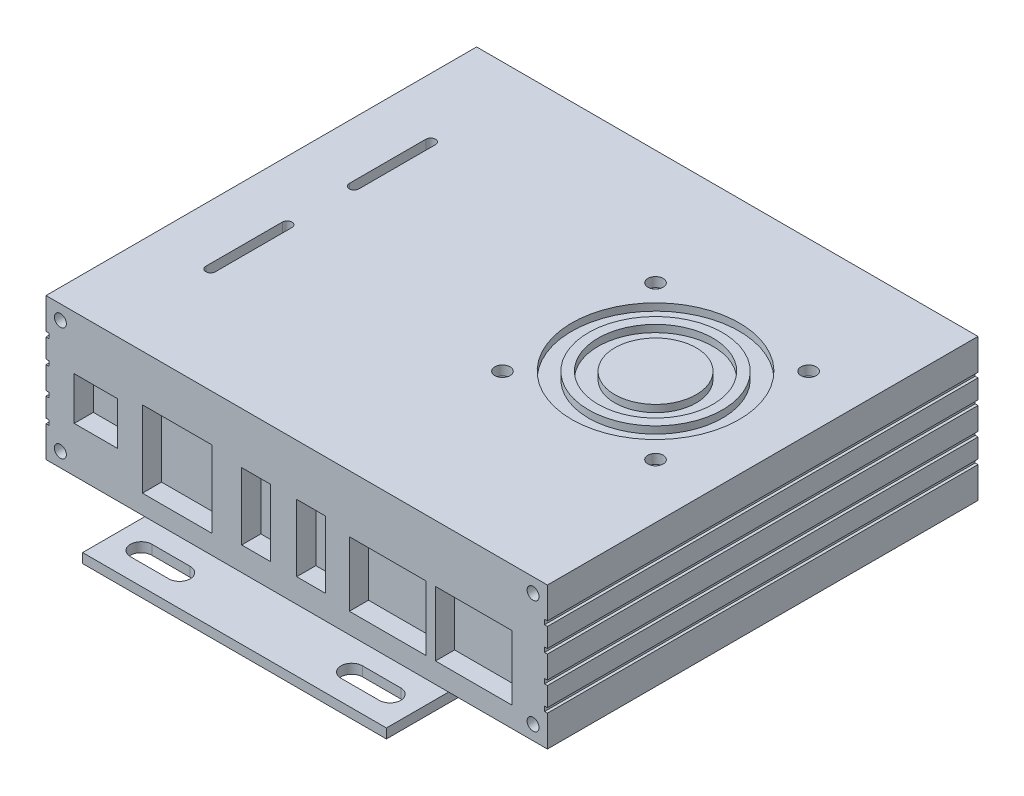
from build123d import *

# Parameters (mm, degrees)
SKETCH1_W           = 104.8
SKETCH1_H           = 90
BOSS_EXTRUDE1_DEPTH = 29.7
SKETCH2_W           = 63.5
SKETCH2_H           = 116
BOSS_EXTRUDE2_DEPTH = 2
CUT_EXTRUDE1_DEPTH  = 3
SKETCH4_R           = 1.25
SKETCH4_W           = 9
SKETCH4_H           = 9
SKETCH4_W_2         = 14.5
SKETCH4_H_2         = 16
SKETCH4_W_3         = 6
SKETCH4_H_3         = 14
SKETCH4_W_4         = 16
SKETCH4_H_4         = 13.5
CUT_EXTRUDE2_DEPTH  = 4
CUT_EXTRUDE4_START  = 2
SKETCH5_R           = 1.25
CUT_EXTRUDE4_DEPTH  = 2
SKETCH6_R           = 17.5
SKETCH6_R_2         = 14
CUT_EXTRUDE5_DEPTH  = 1.5
SKETCH7_R           = 12
SKETCH7_R_2         = 8.5
CUT_EXTRUDE6_DEPTH  = 1.5
SKETCH8_R           = 1.6
CUT_EXTRUDE7_DEPTH  = 2
SKETCH9_W           = 90
SKETCH9_H           = 1
CUT_EXTRUDE8_DEPTH  = 0.6
SKETCH10_W          = 90
SKETCH10_H          = 1
CUT_EXTRUDE10_DEPTH = 0.6


with BuildPart() as part:
    # Sketch1 → Boss-Extrude1 (new body)
    with BuildSketch(Plane(origin=(0, 0, 0), x_dir=(1, 0, 0), z_dir=(0, 1, 0))):
        Rectangle(SKETCH1_W, SKETCH1_H)
    extrude(amount=BOSS_EXTRUDE1_DEPTH)

    # Sketch2 → Boss-Extrude2 (add)
    with BuildSketch(Plane(origin=(0, 0, 0), x_dir=(1, 0, 0), z_dir=(0, 1, 0))):
        Rectangle(SKETCH2_W, SKETCH2_H)
    extrude(amount=-BOSS_EXTRUDE2_DEPTH)

    # Sketch3 → Cut-Extrude1 (cut)
    with BuildSketch(Plane.XZ.offset(2)):
        with BuildLine():
            Line((18, 53.75), (26, 53.75))
            ThreePointArc((26, 53.75), (28.25, 51.5), (26, 49.25))
            Line((26, 49.25), (18, 49.25))
            ThreePointArc((18, 49.25), (15.75, 51.5), (18, 53.75))
        make_face()
        with BuildLine():
            Line((-26, 53.75), (-18, 53.75))
            ThreePointArc((-18, 53.75), (-15.75, 51.5), (-18, 49.25))
            Line((-18, 49.25), (-26, 49.25))
            ThreePointArc((-26, 49.25), (-28.25, 51.5), (-26, 53.75))
        make_face()
        with BuildLine():
            Line((18, -49.25), (26, -49.25))
            ThreePointArc((26, -49.25), (28.25, -51.5), (26, -53.75))
            Line((26, -53.75), (18, -53.75))
            ThreePointArc((18, -53.75), (15.75, -51.5), (18, -49.25))
        make_face()
        with BuildLine():
            Line((-26, -49.25), (-18, -49.25))
            ThreePointArc((-18, -49.25), (-15.75, -51.5), (-18, -53.75))
            Line((-18, -53.75), (-26, -53.75))
            ThreePointArc((-26, -53.75), (-28.25, -51.5), (-26, -49.25))
        make_face()
    extrude(amount=-CUT_EXTRUDE1_DEPTH, mode=Mode.SUBTRACT)

    # Sketch4 → Cut-Extrude2 (cut)
    with BuildSketch(Plane.XY.offset(45)):
        with Locations((49.4, 3)):
            Circle(SKETCH4_R)
        with Locations((49.4, 26.7)):
            Circle(SKETCH4_R)
        with Locations((-49.4, 3)):
            Circle(SKETCH4_R)
        with Locations((-49.4, 26.7)):
            Circle(SKETCH4_R)
        with Locations((-42, 14)):
            Rectangle(SKETCH4_W, SKETCH4_H)
        with Locations((-25, 12)):
            Rectangle(SKETCH4_W_2, SKETCH4_H_2)
        with Locations((-8.5, 12)):
            Rectangle(SKETCH4_W_3, SKETCH4_H_3)
        with Locations((3, 12)):
            Rectangle(SKETCH4_W_3, SKETCH4_H_3)
        with Locations((19, 11)):
            Rectangle(SKETCH4_W_4, SKETCH4_H_4)
        with Locations((37, 11)):
            Rectangle(SKETCH4_W_4, SKETCH4_H_4)
    extrude(amount=-CUT_EXTRUDE2_DEPTH, mode=Mode.SUBTRACT)

    # Sketch5 → Cut-Extrude4 (cut)
    with BuildSketch(Plane.XY.offset(-45).offset(CUT_EXTRUDE4_START)):
        with Locations((49.4, 3)):
            Circle(SKETCH5_R)
        with Locations((49.4, 26.7)):
            Circle(SKETCH5_R)
        with Locations((-49.4, 3)):
            Circle(SKETCH5_R)
        with Locations((-49.4, 26.7)):
            Circle(SKETCH5_R)
    extrude(amount=-CUT_EXTRUDE4_DEPTH, mode=Mode.SUBTRACT)

    # Sketch6 → Cut-Extrude5 (cut)
    with BuildSketch(Plane(origin=(0, 29.7, 0), x_dir=(1, 0, 0), z_dir=(0, 1, 0))):
        with Locations((25, 5)):
            Circle(SKETCH6_R)
        with Locations((25, 5)):
            Circle(SKETCH6_R_2, mode=Mode.SUBTRACT)
    extrude(amount=-CUT_EXTRUDE5_DEPTH, mode=Mode.SUBTRACT)

    # Sketch7 → Cut-Extrude6 (cut)
    with BuildSketch(Plane(origin=(0, 29.7, 0), x_dir=(1, 0, 0), z_dir=(0, 1, 0))):
        with Locations((25, 5)):
            Circle(SKETCH7_R)
        with Locations((25, 5)):
            Circle(SKETCH7_R_2, mode=Mode.SUBTRACT)
    extrude(amount=-CUT_EXTRUDE6_DEPTH, mode=Mode.SUBTRACT)

    # Sketch8 → Cut-Extrude7 (cut)
    with BuildSketch(Plane(origin=(0, 29.7, 0), x_dir=(1, 0, 0), z_dir=(0, 1, 0))):
        with Locations((41, -11)):
            Circle(SKETCH8_R)
        with Locations((41, 21)):
            Circle(SKETCH8_R)
        with Locations((9, -11)):
            Circle(SKETCH8_R)
        with Locations((9, 21)):
            Circle(SKETCH8_R)
        with BuildLine():
            Line((-39, -7), (-39, -23))
            ThreePointArc((-39, -23), (-40, -24), (-41, -23))
            Line((-41, -23), (-41, -7))
            ThreePointArc((-41, -7), (-40, -6), (-39, -7))
        make_face()
        with BuildLine():
            Line((-39, 23), (-39, 7))
            ThreePointArc((-39, 7), (-40, 6), (-41, 7))
            Line((-41, 7), (-41, 23))
            ThreePointArc((-41, 23), (-40, 24), (-39, 23))
        make_face()
    extrude(amount=-CUT_EXTRUDE7_DEPTH, mode=Mode.SUBTRACT)

    # Sketch9 → Cut-Extrude8 (cut)
    with BuildSketch(Plane(origin=(52.4, 0, 0), x_dir=(0, 0, -1), z_dir=(1, 0, 0))):
        with Locations((0, 7)):
            Rectangle(SKETCH9_W, SKETCH9_H)
        with Locations((0, 12)):
            Rectangle(SKETCH9_W, SKETCH9_H)
        with Locations((0, 17.7)):
            Rectangle(SKETCH9_W, SKETCH9_H)
        with Locations((0, 22.7)):
            Rectangle(SKETCH9_W, SKETCH9_H)
    extrude(amount=-CUT_EXTRUDE8_DEPTH, mode=Mode.SUBTRACT)

    # Sketch10 → Cut-Extrude10 (cut)
    with BuildSketch(Plane(origin=(-52.4, 0, 0), x_dir=(0, 0, -1), z_dir=(1, 0, 0))):
        with Locations((0, 7)):
            Rectangle(SKETCH10_W, SKETCH10_H)
        with Locations((0, 12)):
            Rectangle(SKETCH10_W, SKETCH10_H)
        with Locations((0, 17.7)):
            Rectangle(SKETCH10_W, SKETCH10_H)
        with Locations((0, 22.7)):
            Rectangle(SKETCH10_W, SKETCH10_H)
    extrude(amount=CUT_EXTRUDE10_DEPTH, mode=Mode.SUBTRACT)


solid = part.part
